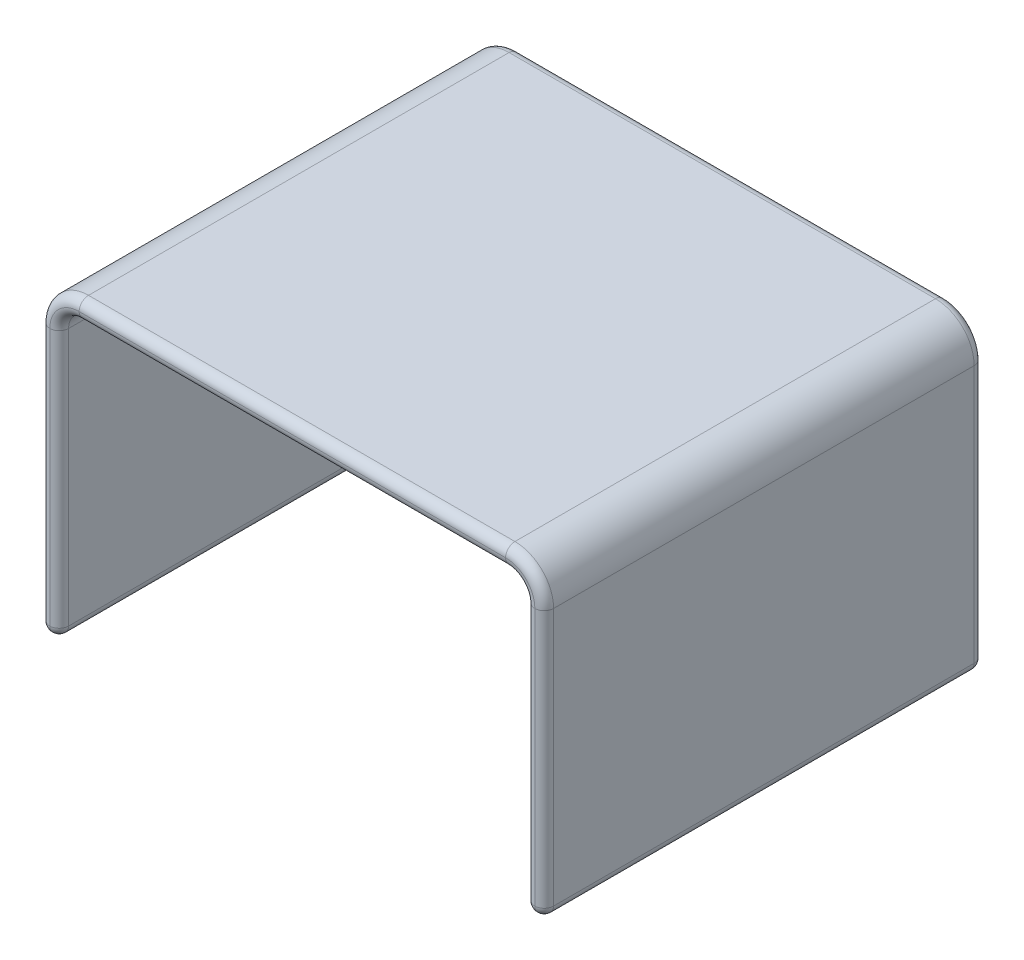
from build123d import *

# Parameters (mm, degrees)
SKETCH1_W           = 10.922
SKETCH1_H           = 0.4064
SKETCH1_W_2         = 0.4064
SKETCH1_H_2         = 6.223
BOSS_EXTRUDE1_DEPTH = 4.7625
FILLET1_R           = 0.8382
FILLET2_R           = 0.4318
FILLET3_R           = 0.2032


with BuildPart() as part:
    # Sketch1 → Boss-Extrude1 (new, symmetric)
    with BuildSketch(Plane.XY):
        Rectangle(SKETCH1_W, SKETCH1_H)
        with Locations((-5.2578, -3.3147)):
            Rectangle(SKETCH1_W_2, SKETCH1_H_2)
        with Locations((5.2578, -3.3147)):
            Rectangle(SKETCH1_W_2, SKETCH1_H_2)
    extrude(amount=BOSS_EXTRUDE1_DEPTH, both=True)

    # Fillet1
    fillet1_edges = [part.edges().sort_by_distance(p)[0] for p in [
        (-5.461, 0.2032, 0),
        (5.461, 0.2032, 0),
    ]]
    fillet(fillet1_edges, radius=FILLET1_R)

    # Fillet2
    fillet2_edges = [part.edges().sort_by_distance(p)[0] for p in [
        (5.0546, -0.2032, 0),
        (-5.0546, -0.2032, 0),
    ]]
    fillet(fillet2_edges, radius=FILLET2_R)

    # Fillet3
    fillet3_edges = [part.edges().sort_by_distance(p)[0] for p in [
        (-5.0546, -3.5306, -4.7625),
        (-5.2578, -6.4262, -4.7625),
        (5.461, -6.4262, 0),
        (5.0546, -6.4262, 0),
        (-5.0546, -6.4262, 0),
        (-5.461, -6.4262, 0),
        (-5.2578, -6.4262, 4.7625),
        (-5.0546, -3.5306, 4.7625),
        (-5.461, -3.5306, -4.7625),
        (-5.461, -3.5306, 4.7625),
        (5.461, -3.5306, -4.7625),
        (0, 0.2032, -4.7625),
        (5.215496904, -0.042303096, -4.7625),
        (-5.215496904, -0.042303096, -4.7625),
        (0, 0.2032, 4.7625),
        (5.461, -3.5306, 4.7625),
        (5.215496904, -0.042303096, 4.7625),
        (5.0546, -3.5306, 4.7625),
        (-5.215496904, -0.042303096, 4.7625),
        (5.2578, -6.4262, 4.7625),
        (0, -0.2032, -4.7625),
        (0, -0.2032, 4.7625),
        (-4.928128708, -0.329671292, -4.7625),
        (-4.928128708, -0.329671292, 4.7625),
        (4.928128708, -0.329671292, -4.7625),
        (4.928128708, -0.329671292, 4.7625),
        (5.2578, -6.4262, -4.7625),
        (5.0546, -3.5306, -4.7625),
    ]]
    fillet(fillet3_edges, radius=FILLET3_R - 0.0001)  # a hair under: the kernel refuses the full size


solid = part.part
